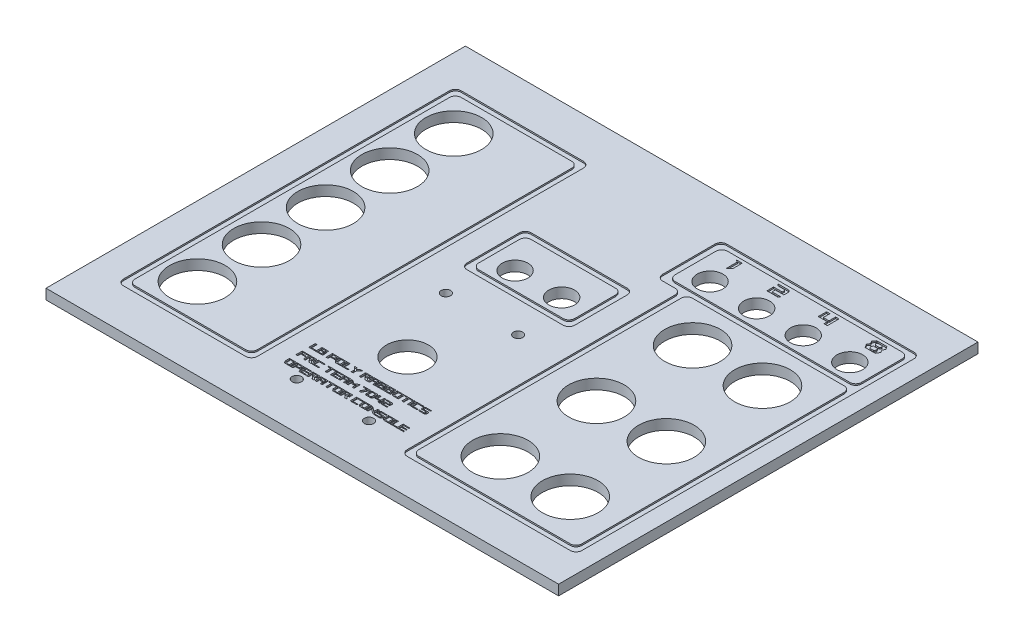
from build123d import *

# Parameters (mm, degrees)
SKETCH1_W           = 279.4
SKETCH1_H           = 228.6
BOSS_EXTRUDE1_DEPTH = 5.55625
SKETCH2_R           = 15.160625
CUT_EXTRUDE1_DEPTH  = 181.586411211
SKETCH3_R           = 7.0246875
SKETCH3_R_2         = 15.160625
CUT_EXTRUDE2_DEPTH  = 181.586411211
SKETCH4_W           = 73.025
SKETCH4_H           = 184.15
SKETCH4_W_2         = 66.675
SKETCH4_H_2         = 177.8
SKETCH4_W_3         = 88.9
SKETCH4_H_3         = 149.225
SKETCH4_W_4         = 101.6
SKETCH4_H_4         = 28.575
CUT_EXTRUDE3_DEPTH  = 0.79375
FILLET1_R           = 3.175
SKETCH5_W           = 1.743010591
SKETCH5_H           = 0.819065149
SKETCH5_H_2         = 1.141619432
SKETCH5_W_2         = 1.782964988
SKETCH5_H_3         = 1.234104295
SKETCH5_W_3         = 1.807936488
SKETCH5_H_4         = 0.965318114
SKETCH5_W_4         = 1.743010592
SKETCH5_W_5         = 1.049133865
SKETCH5_H_5         = 3.5
SKETCH5_W_6         = 1.807936487
SKETCH5_W_7         = 1.782964989
CUT_EXTRUDE4_DEPTH  = 0.79375
CUT_EXTRUDE5_DEPTH  = 0.79375
CUT_EXTRUDE6_DEPTH  = 0.79375
SKETCH8_R           = 7.0246875
CUT_EXTRUDE7_DEPTH  = 181.586411211
SKETCH9_R           = 11.43
SKETCH9_R_2         = 2.54
CUT_EXTRUDE8_DEPTH  = 181.586411211


with BuildPart() as part:
    # Sketch1 → Boss-Extrude1 (new body)
    with BuildSketch(Plane(origin=(0, 0, 0), x_dir=(1, 0, 0), z_dir=(0, 1, 0))):
        Rectangle(SKETCH1_W, SKETCH1_H)
    extrude(amount=BOSS_EXTRUDE1_DEPTH)

    # Sketch2 → Cut-Extrude1 (cut, through all)
    with BuildSketch(Plane(origin=(0, 5.55625, 0), x_dir=(1, 0, 0), z_dir=(0, 1, 0))):
        with Locations((-101.6, 69.85)):
            Circle(SKETCH2_R)
        with Locations((-101.6, 34.925)):
            Circle(SKETCH2_R)
        with Locations((-101.6, 0)):
            Circle(SKETCH2_R)
        with Locations((-101.6, -34.925)):
            Circle(SKETCH2_R)
        with Locations((-101.6, -69.85)):
            Circle(SKETCH2_R)
    extrude(amount=-CUT_EXTRUDE1_DEPTH, mode=Mode.SUBTRACT)

    # Sketch3 → Cut-Extrude2 (cut, through all)
    with BuildSketch(Plane(origin=(0, 5.55625, 0), x_dir=(1, 0, 0), z_dir=(0, 1, 0))):
        with Locations((38.1, 69.85)):
            Circle(SKETCH3_R)
        with Locations((63.5, 69.85)):
            Circle(SKETCH3_R)
        with Locations((88.9, 69.85)):
            Circle(SKETCH3_R)
        with Locations((114.3, 69.85)):
            Circle(SKETCH3_R)
        with Locations((63.5, 34.925)):
            Circle(SKETCH3_R_2)
        with Locations((101.6, 34.925)):
            Circle(SKETCH3_R_2)
        with Locations((101.6, -17.4625)):
            Circle(SKETCH3_R_2)
        with Locations((63.5, -17.4625)):
            Circle(SKETCH3_R_2)
        with Locations((101.6, -69.85)):
            Circle(SKETCH3_R_2)
        with Locations((63.5, -69.85)):
            Circle(SKETCH3_R_2)
    extrude(amount=-CUT_EXTRUDE2_DEPTH, mode=Mode.SUBTRACT)

    # Sketch4 → Cut-Extrude3 (cut)
    # profile 1 of 2: a face of its own
    with BuildSketch(Plane(origin=(0, 5.55625, 0), x_dir=(1, 0, 0), z_dir=(0, 1, 0))):
        with Locations((-86.439375, 0)):
            Rectangle(SKETCH4_W, SKETCH4_H)
        with Locations((-86.439375, 0)):
            Rectangle(SKETCH4_W_2, SKETCH4_H_2, mode=Mode.SUBTRACT)
    # profile 2 of 2: a face of its own
    with BuildSketch(Plane(origin=(0, 5.55625, 0), x_dir=(1, 0, 0), z_dir=(0, 1, 0))):
        Polygon((130.175, 60.325), (130.175, -95.25), (34.925, -95.25), (34.925, 57.15), (21.779463134, 57.15), (21.779463134, 92.075), (130.175, 92.075), align=None)
        with Locations((82.55, -17.4625)):
            Rectangle(SKETCH4_W_3, SKETCH4_H_3, mode=Mode.SUBTRACT)
        with Locations((76.2, 74.6125)):
            Rectangle(SKETCH4_W_4, SKETCH4_H_4, mode=Mode.SUBTRACT)
    extrude(amount=-CUT_EXTRUDE3_DEPTH, mode=Mode.SUBTRACT)

    # Fillet1
    fillet1_edges = [part.edges().sort_by_distance(p)[0] for p in [
        (130.175, 5.159375, 95.25),
        (127, 5.159375, 92.075),
        (34.925, 5.159375, 95.25),
        (38.1, 5.159375, 92.075),
        (-119.776875, 5.159375, 88.9),
        (-122.951875, 5.159375, 92.075),
        (-49.926875, 5.159375, 92.075),
        (-53.101875, 5.159375, 88.9),
        (38.1, 5.159375, -57.15),
        (127, 5.159375, -57.15),
        (34.925, 5.159375, -57.15),
        (127, 5.159375, -60.325),
        (130.175, 5.159375, -92.075),
        (127, 5.159375, -88.9),
        (21.779463134, 5.159375, -57.15),
        (25.4, 5.159375, -60.325),
        (21.779463134, 5.159375, -92.075),
        (25.4, 5.159375, -88.9),
        (-49.926875, 5.159375, -92.075),
        (-53.101875, 5.159375, -88.9),
        (-122.951875, 5.159375, -92.075),
        (-119.776875, 5.159375, -88.9),
    ]]
    fillet(fillet1_edges, radius=FILLET1_R)

    # Sketch5 → Cut-Extrude4 (cut)
    # profile 1 of 41: a face of its own
    with BuildSketch(Plane(origin=(0, 5.55625, 0), x_dir=(1, 0, 0), z_dir=(0, 1, 0))):
        Polygon((-36.802163997, -70.03379494), (-37.252626826, -70.54878923), (-40.209679135, -70.54878923), (-40.209679135, -67.04878923), (-39.163953361, -67.04878923), (-39.163953361, -70.03379494), align=None)
    # profile 2 of 41: a face of its own
    with BuildSketch(Plane(origin=(0, 5.55625, 0), x_dir=(1, 0, 0), z_dir=(0, 1, 0))):
        Polygon((-32.683092397, -70.55453218), (-36.513720258, -70.55453218), (-36.513720258, -67.04247403), (-32.987744678, -67.04247403), (-32.987744678, -68.375952047), (-32.683092397, -68.375952047), align=None)
        with Locations((-34.598406328, -67.966419473)):
            Rectangle(SKETCH5_W, SKETCH5_H, mode=Mode.SUBTRACT)
        with Locations((-34.598406328, -69.469309596)):
            Rectangle(SKETCH5_W, SKETCH5_H_2, mode=Mode.SUBTRACT)
    # profile 3 of 41: a face of its own
    with BuildSketch(Plane(origin=(0, 5.55625, 0), x_dir=(1, 0, 0), z_dir=(0, 1, 0))):
        Polygon((-29.773910712, -69.305977015), (-29.773910712, -70.544563338), (-30.822713646, -70.544563338), (-30.822713646, -67.043046984), (-26.952131388, -67.043046984), (-26.952131388, -69.305977015), align=None)
        with Locations((-28.892416817, -68.174511999)):
            Rectangle(SKETCH5_W_2, SKETCH5_H_3, mode=Mode.SUBTRACT)
    # profile 4 of 41: a face of its own
    with BuildSketch(Plane(origin=(0, 5.55625, 0), x_dir=(1, 0, 0), z_dir=(0, 1, 0))):
        Polygon((-22.605629343, -70.553124491), (-22.605629343, -67.044453969), (-26.568057888, -67.044453969), (-26.568057888, -69.594269754), (-25.714708614, -70.553124491), align=None)
        Polygon((-23.654763208, -67.547344949), (-23.654763208, -70.050234216), (-24.928968668, -70.050234216), (-25.518924023, -69.366287524), (-25.518924023, -67.547344949), align=None, mode=Mode.SUBTRACT)
    # profile 5 of 41: a face of its own
    with BuildSketch(Plane(origin=(0, 5.55625, 0), x_dir=(1, 0, 0), z_dir=(0, 1, 0))):
        Polygon((-18.813721064, -70.03379494), (-19.264183893, -70.54878923), (-22.221236202, -70.54878923), (-22.221236202, -67.04878923), (-21.175510428, -67.04878923), (-21.175510428, -70.03379494), align=None)
    # profile 6 of 41: a face of its own
    with BuildSketch(Plane(origin=(0, 5.55625, 0), x_dir=(1, 0, 0), z_dir=(0, 1, 0))):
        Polygon((-17.088287191, -70.553125196), (-16.039154031, -70.553125196), (-16.039154031, -68.905006299), (-14.401023733, -67.057115414), (-15.609644258, -67.057115414), (-16.563737545, -68.135884147), (-17.517796964, -67.057115414), (-18.726417488, -67.057115414), (-17.088287191, -68.905006299), align=None)
    # profile 7 of 41: a face of its own
    with BuildSketch(Plane(origin=(0, 5.55625, 0), x_dir=(1, 0, 0), z_dir=(0, 1, 0))):
        Polygon((-8.386582238, -70.573506709), (-9.620174261, -70.573506709), (-11.503025243, -68.425957843), (-9.735043154, -68.425957843), (-9.735043154, -67.599367375), (-11.635973953, -67.599367375), (-11.635973953, -70.573506709), (-12.694765486, -70.573506709), (-12.694765486, -67.084954507), (-8.706217418, -67.084954507), (-8.706217418, -68.940370711), (-9.814951949, -68.940370711), align=None)
    # profile 8 of 41: a face of its own
    with BuildSketch(Plane(origin=(0, 5.55625, 0), x_dir=(1, 0, 0), z_dir=(0, 1, 0))):
        Polygon((-4.199478651, -67.084954507), (-4.199478651, -70.572393964), (-5.248281586, -70.572393964), (-5.248281586, -69.084092657), (-7.096172471, -69.084092657), (-7.096172471, -70.572393964), (-8.164952604, -70.572393964), (-8.164952604, -67.084954507), align=None)
        with Locations((-6.177221328, -68.082026432)):
            Rectangle(SKETCH5_W_3, SKETCH5_H_4, mode=Mode.SUBTRACT)
    # profile 9 of 41: a face of its own
    with BuildSketch(Plane(origin=(0, 5.55625, 0), x_dir=(1, 0, 0), z_dir=(0, 1, 0))):
        Polygon((0.010555813, -70.55453218), (-3.820072048, -70.55453218), (-3.820072048, -67.04247403), (-0.294096468, -67.04247403), (-0.294096468, -68.375952047), (0.010555813, -68.375952047), align=None)
        with Locations((-1.904758118, -67.966419473)):
            Rectangle(SKETCH5_W, SKETCH5_H, mode=Mode.SUBTRACT)
        with Locations((-1.904758118, -69.469309596)):
            Rectangle(SKETCH5_W, SKETCH5_H_2, mode=Mode.SUBTRACT)
    # profile 10 of 41: a face of its own
    with BuildSketch(Plane(origin=(0, 5.55625, 0), x_dir=(1, 0, 0), z_dir=(0, 1, 0))):
        Polygon((4.218649146, -70.55453218), (0.388021286, -70.55453218), (0.388021286, -67.04247403), (3.913996865, -67.04247403), (3.913996865, -68.375952047), (4.218649146, -68.375952047), align=None)
        with Locations((2.303335216, -67.966419473)):
            Rectangle(SKETCH5_W_4, SKETCH5_H, mode=Mode.SUBTRACT)
        with Locations((2.303335216, -69.469309596)):
            Rectangle(SKETCH5_W_4, SKETCH5_H_2, mode=Mode.SUBTRACT)
    # profile 11 of 41: a face of its own
    with BuildSketch(Plane(origin=(0, 5.55625, 0), x_dir=(1, 0, 0), z_dir=(0, 1, 0))):
        Polygon((8.562006998, -70.553124491), (8.562006998, -67.044453969), (4.599578454, -67.044453969), (4.599578454, -69.594269754), (5.452927727, -70.553124491), align=None)
        Polygon((7.512873133, -67.547344949), (7.512873133, -70.050234216), (6.238667674, -70.050234216), (5.648712319, -69.366287524), (5.648712319, -67.547344949), align=None, mode=Mode.SUBTRACT)
    # profile 12 of 41: a face of its own
    with BuildSketch(Plane(origin=(0, 5.55625, 0), x_dir=(1, 0, 0), z_dir=(0, 1, 0))):
        Polygon((12.839335381, -67.563822328), (11.5483703, -67.563822328), (11.5483703, -70.54878923), (10.506626277, -70.54878923), (10.506626277, -67.563822328), (9.200707932, -67.563822328), (8.757094448, -67.04878923), (13.28310551, -67.04878923), align=None)
    # profile 13 of 41: a face of its own
    with BuildSketch(Plane(origin=(0, 5.55625, 0), x_dir=(1, 0, 0), z_dir=(0, 1, 0))):
        with Locations((14.09524546, -68.79878923)):
            Rectangle(SKETCH5_W_5, SKETCH5_H_5)
    # profile 14 of 41: a face of its own
    with BuildSketch(Plane(origin=(0, 5.55625, 0), x_dir=(1, 0, 0), z_dir=(0, 1, 0))):
        Polygon((19.063454202, -70.03379494), (18.615261317, -70.54878923), (15.138597919, -70.54878923), (15.138597919, -67.04878923), (19.058560804, -67.04878923), (18.615261317, -67.563822328), (16.204509047, -67.563822328), (16.204509047, -70.03379494), align=None)
    # profile 15 of 41: a face of its own
    with BuildSketch(Plane(origin=(0, 5.55625, 0), x_dir=(1, 0, 0), z_dir=(0, 1, 0))):
        Polygon((23.383155104, -70.029679123), (22.930792776, -70.558867441), (19.794082567, -70.558867441), (19.346691253, -70.044454573), (22.14537247, -70.044454573), (22.32930001, -69.832673123), (22.32930001, -69.079135754), (19.480908647, -69.079135754), (19.480908647, -67.638932277), (19.953155034, -67.084954507), (23.50276075, -67.084954507), (23.06501017, -67.599367375), (20.743546354, -67.599367375), (20.519850698, -67.85180601), (20.519850698, -68.564685489), (23.383155104, -68.564685489), align=None)
    # profile 16 of 41: a face of its own
    with BuildSketch(Plane(origin=(0, 5.55625, 0), x_dir=(1, 0, 0), z_dir=(0, 1, 0))):
        Polygon((-39.190410166, -75.905689832), (-39.190410166, -77.568791629), (-40.209679135, -77.568791629), (-40.209679135, -74.096516413), (-36.432222432, -74.096516413), (-36.872072903, -74.610929281), (-39.190410166, -74.610929281), (-39.190410166, -75.391276965), (-36.577284329, -75.391276965), (-37.026961815, -75.905689832), align=None)
    # profile 17 of 41: a face of its own
    with BuildSketch(Plane(origin=(0, 5.55625, 0), x_dir=(1, 0, 0), z_dir=(0, 1, 0))):
        Polygon((-31.83167367, -77.585068614), (-33.065265693, -77.585068614), (-34.948116675, -75.437519748), (-33.180134585, -75.437519748), (-33.180134585, -74.610929281), (-35.081065384, -74.610929281), (-35.081065384, -77.585068614), (-36.139856918, -77.585068614), (-36.139856918, -74.096516413), (-32.15130885, -74.096516413), (-32.15130885, -75.951932616), (-33.26004338, -75.951932616), align=None)
    # profile 18 of 41: a face of its own
    with BuildSketch(Plane(origin=(0, 5.55625, 0), x_dir=(1, 0, 0), z_dir=(0, 1, 0))):
        Polygon((-27.68800031, -77.045356846), (-28.136193195, -77.560351135), (-31.612856593, -77.560351135), (-31.612856593, -74.060351135), (-27.692893708, -74.060351135), (-28.136193195, -74.575384233), (-30.546945465, -74.575384233), (-30.546945465, -77.045356846), align=None)
    # profile 19 of 41: a face of its own
    with BuildSketch(Plane(origin=(0, 5.55625, 0), x_dir=(1, 0, 0), z_dir=(0, 1, 0))):
        Polygon((-21.981480887, -74.575384233), (-23.272445969, -74.575384233), (-23.272445969, -77.560351135), (-24.314189992, -77.560351135), (-24.314189992, -74.575384233), (-25.620108337, -74.575384233), (-26.06372182, -74.060351135), (-21.537710758, -74.060351135), align=None)
    # profile 20 of 41: a face of its own
    with BuildSketch(Plane(origin=(0, 5.55625, 0), x_dir=(1, 0, 0), z_dir=(0, 1, 0))):
        Polygon((-17.881404278, -77.056016479), (-17.431980811, -77.570429347), (-21.346958569, -77.570429347), (-21.346958569, -74.096516413), (-17.422102287, -74.096516413), (-17.866423496, -74.610929281), (-20.298303813, -74.610929281), (-20.298303813, -75.576247395), (-17.656692545, -75.576247395), (-17.656692545, -76.09069766), (-20.298303813, -76.09069766), (-20.298303813, -77.056016479), align=None)
    # profile 21 of 41: a face of its own
    with BuildSketch(Plane(origin=(0, 5.55625, 0), x_dir=(1, 0, 0), z_dir=(0, 1, 0))):
        Polygon((-13.170578726, -74.096516413), (-13.170578726, -77.583955869), (-14.21938166, -77.583955869), (-14.21938166, -76.095654562), (-16.067272545, -76.095654562), (-16.067272545, -77.583955869), (-17.136052678, -77.583955869), (-17.136052678, -74.096516413), align=None)
        with Locations((-15.148321403, -75.093588338)):
            Rectangle(SKETCH5_W_6, SKETCH5_H_4, mode=Mode.SUBTRACT)
    # profile 22 of 41: a face of its own
    with BuildSketch(Plane(origin=(0, 5.55625, 0), x_dir=(1, 0, 0), z_dir=(0, 1, 0))):
        Polygon((-12.79204355, -77.560351135), (-12.79204355, -74.060351135), (-10.64467038, -75.46037442), (-8.497245702, -74.060351135), (-8.497245702, -77.560351135), (-9.528634209, -77.560351135), (-9.528634209, -75.555373367), (-10.64467038, -76.265365494), (-11.750741943, -75.555373367), (-11.750741943, -77.560351135), align=None)
    # profile 23 of 41: a face of its own
    with BuildSketch(Plane(origin=(0, 5.55625, 0), x_dir=(1, 0, 0), z_dir=(0, 1, 0))):
        Polygon((-5.907196803, -77.564687102), (-4.701469275, -77.564687102), (-2.855625362, -74.056015874), (-6.780480939, -74.056015874), (-6.338877029, -74.558906855), (-4.438491666, -74.558906855), align=None)
    # profile 24 of 41: a face of its own
    with BuildSketch(Plane(origin=(0, 5.55625, 0), x_dir=(1, 0, 0), z_dir=(0, 1, 0))):
        Polygon((1.259981699, -74.609532881), (0.796130647, -74.056015874), (-2.196113199, -74.056015874), (-2.664873878, -74.609532881), (-2.664873878, -77.01133803), (-2.196113199, -77.564686396), (0.796130647, -77.564686396), (1.259981699, -77.01133803), align=None)
        Polygon((0.248420801, -74.851731719), (0.248420801, -76.759047573), (-0.004468012, -77.061796121), (-1.395364246, -77.061796121), (-1.653312275, -76.759047573), (-1.653312275, -74.851731719), (-1.395364246, -74.558906855), (-0.004468012, -74.558906855), align=None, mode=Mode.SUBTRACT)
    # profile 25 of 41: a face of its own
    with BuildSketch(Plane(origin=(0, 5.55625, 0), x_dir=(1, 0, 0), z_dir=(0, 1, 0))):
        Polygon((4.410271351, -77.564687102), (5.421832955, -77.564687102), (5.421832955, -74.066712199), (4.410271351, -74.066712199), (4.410271351, -76.044454876), (2.693509411, -76.044454876), (2.693509411, -74.066712199), (1.681947807, -74.066712199), (1.681947807, -76.547345856), (4.410271351, -76.547345856), align=None)
    # profile 26 of 41: a face of its own
    with BuildSketch(Plane(origin=(0, 5.55625, 0), x_dir=(1, 0, 0), z_dir=(0, 1, 0))):
        Polygon((9.180457662, -77.570429347), (5.871108244, -77.570429347), (5.871108244, -75.576247395), (8.451701983, -75.576247395), (8.451701983, -74.863367916), (8.227085507, -74.610929281), (6.190562788, -74.610929281), (5.75131279, -74.096516413), (9.02073039, -74.096516413), (9.494920729, -74.650494182), (9.494920729, -76.09069766), (6.929301421, -76.09069766), (6.929301421, -77.056016479), (9.629925583, -77.056016479), align=None)
    # profile 27 of 41: a face of its own
    with BuildSketch(Plane(origin=(0, 5.55625, 0), x_dir=(1, 0, 0), z_dir=(0, 1, 0))):
        Polygon((-36.247250591, -84.576248302), (-36.247250591, -81.06757778), (-40.209679135, -81.06757778), (-40.209679135, -83.617393565), (-39.356329862, -84.576248302), align=None)
        Polygon((-37.296384456, -81.57046876), (-37.296384456, -84.073358027), (-38.570589915, -84.073358027), (-39.16054527, -83.389411335), (-39.16054527, -81.57046876), align=None, mode=Mode.SUBTRACT)
    # profile 28 of 41: a face of its own
    with BuildSketch(Plane(origin=(0, 5.55625, 0), x_dir=(1, 0, 0), z_dir=(0, 1, 0))):
        Polygon((-34.814374156, -83.329100826), (-34.814374156, -84.567687149), (-35.86317709, -84.567687149), (-35.86317709, -81.066170796), (-31.992594832, -81.066170796), (-31.992594832, -83.329100826), align=None)
        with Locations((-33.93288026, -82.197635812)):
            Rectangle(SKETCH5_W_7, SKETCH5_H_3, mode=Mode.SUBTRACT)
    # profile 29 of 41: a face of its own
    with BuildSketch(Plane(origin=(0, 5.55625, 0), x_dir=(1, 0, 0), z_dir=(0, 1, 0))):
        Polygon((-28.147302302, -84.067578385), (-27.697878834, -84.581991252), (-31.612856593, -84.581991252), (-31.612856593, -81.108078319), (-27.68800031, -81.108078319), (-28.132321519, -81.622491186), (-30.564201836, -81.622491186), (-30.564201836, -82.5878093), (-27.922590568, -82.5878093), (-27.922590568, -83.102259565), (-30.564201836, -83.102259565), (-30.564201836, -84.067578385), align=None)
    # profile 30 of 41: a face of its own
    with BuildSketch(Plane(origin=(0, 5.55625, 0), x_dir=(1, 0, 0), z_dir=(0, 1, 0))):
        Polygon((-23.091787515, -84.59663052), (-24.325379538, -84.59663052), (-26.20823052, -82.449081654), (-24.44024843, -82.449081654), (-24.44024843, -81.622491186), (-26.341179229, -81.622491186), (-26.341179229, -84.59663052), (-27.399970763, -84.59663052), (-27.399970763, -81.108078319), (-23.411422695, -81.108078319), (-23.411422695, -82.963494522), (-24.520157225, -82.963494522), align=None)
    # profile 31 of 41: a face of its own
    with BuildSketch(Plane(origin=(0, 5.55625, 0), x_dir=(1, 0, 0), z_dir=(0, 1, 0))):
        Polygon((-18.904683928, -81.108078319), (-18.904683928, -84.595517775), (-19.953486863, -84.595517775), (-19.953486863, -83.107216468), (-21.801377747, -83.107216468), (-21.801377747, -84.595517775), (-22.870157881, -84.595517775), (-22.870157881, -81.108078319), align=None)
        with Locations((-20.882426605, -82.105150243)):
            Rectangle(SKETCH5_W_6, SKETCH5_H_4, mode=Mode.SUBTRACT)
    # profile 32 of 41: a face of its own
    with BuildSketch(Plane(origin=(0, 5.55625, 0), x_dir=(1, 0, 0), z_dir=(0, 1, 0))):
        Polygon((-14.628878249, -81.586946139), (-15.91984333, -81.586946139), (-15.91984333, -84.571913041), (-16.961587353, -84.571913041), (-16.961587353, -81.586946139), (-18.267505698, -81.586946139), (-18.711119182, -81.071913041), (-14.18510812, -81.071913041), align=None)
    # profile 33 of 41: a face of its own
    with BuildSketch(Plane(origin=(0, 5.55625, 0), x_dir=(1, 0, 0), z_dir=(0, 1, 0))):
        Polygon((-10.027592125, -84.576248302), (-10.027592125, -81.06757778), (-13.99002067, -81.06757778), (-13.99002067, -83.617393565), (-13.136671397, -84.576248302), align=None)
        Polygon((-11.076725991, -81.57046876), (-11.076725991, -84.073358027), (-12.35093145, -84.073358027), (-12.940886805, -83.389411335), (-12.940886805, -81.57046876), align=None, mode=Mode.SUBTRACT)
    # profile 34 of 41: a face of its own
    with BuildSketch(Plane(origin=(0, 5.55625, 0), x_dir=(1, 0, 0), z_dir=(0, 1, 0))):
        Polygon((-5.334558501, -84.59663052), (-6.568150524, -84.59663052), (-8.451001507, -82.449081654), (-6.683019417, -82.449081654), (-6.683019417, -81.622491186), (-8.583950216, -81.622491186), (-8.583950216, -84.59663052), (-9.64274175, -84.59663052), (-9.64274175, -81.108078319), (-5.654193681, -81.108078319), (-5.654193681, -82.963494522), (-6.762928212, -82.963494522), align=None)
    # profile 35 of 41: a face of its own
    with BuildSketch(Plane(origin=(0, 5.55625, 0), x_dir=(1, 0, 0), z_dir=(0, 1, 0))):
        Polygon((0.288883943, -84.056918751), (-0.159308942, -84.571913041), (-3.63597234, -84.571913041), (-3.63597234, -81.071913041), (0.283990545, -81.071913041), (-0.159308942, -81.586946139), (-2.570061212, -81.586946139), (-2.570061212, -84.056918751), align=None)
    # profile 36 of 41: a face of its own
    with BuildSketch(Plane(origin=(0, 5.55625, 0), x_dir=(1, 0, 0), z_dir=(0, 1, 0))):
        Polygon((4.585127584, -84.576248302), (4.585127584, -81.06757778), (0.622699039, -81.06757778), (0.622699039, -83.617393565), (1.476048312, -84.576248302), align=None)
        Polygon((3.535993718, -81.57046876), (3.535993718, -84.073358027), (2.261788259, -84.073358027), (1.671832904, -83.389411335), (1.671832904, -81.57046876), align=None, mode=Mode.SUBTRACT)
    # profile 37 of 41: a face of its own
    with BuildSketch(Plane(origin=(0, 5.55625, 0), x_dir=(1, 0, 0), z_dir=(0, 1, 0))):
        Polygon((8.890041041, -84.571913041), (6.048010742, -82.666934164), (6.048010742, -84.571913041), (5.011428248, -84.571913041), (5.011428248, -81.071913041), (7.868229763, -82.961930893), (7.868229763, -81.071913041), (8.890041041, -81.071913041), align=None)
    # profile 38 of 41: a face of its own
    with BuildSketch(Plane(origin=(0, 5.55625, 0), x_dir=(1, 0, 0), z_dir=(0, 1, 0))):
        Polygon((13.255985433, -84.052802935), (12.803623104, -84.581991252), (9.666912895, -84.581991252), (9.219521581, -84.067578385), (12.018202798, -84.067578385), (12.202130338, -83.855796934), (12.202130338, -83.102259565), (9.353738975, -83.102259565), (9.353738975, -81.662056088), (9.825985362, -81.108078319), (13.375591078, -81.108078319), (12.937840498, -81.622491186), (10.616376683, -81.622491186), (10.392681026, -81.874929821), (10.392681026, -82.5878093), (13.255985433, -82.5878093), align=None)
    # profile 39 of 41: a face of its own
    with BuildSketch(Plane(origin=(0, 5.55625, 0), x_dir=(1, 0, 0), z_dir=(0, 1, 0))):
        Polygon((17.671835424, -84.576248302), (17.671835424, -81.06757778), (13.70940688, -81.06757778), (13.70940688, -83.617393565), (14.562756153, -84.576248302), align=None)
        Polygon((16.622701559, -81.57046876), (16.622701559, -84.073358027), (15.3484961, -84.073358027), (14.758540745, -83.389411335), (14.758540745, -81.57046876), align=None, mode=Mode.SUBTRACT)
    # profile 40 of 41: a face of its own
    with BuildSketch(Plane(origin=(0, 5.55625, 0), x_dir=(1, 0, 0), z_dir=(0, 1, 0))):
        Polygon((21.463743703, -84.056918751), (21.013280874, -84.571913041), (18.056228565, -84.571913041), (18.056228565, -81.071913041), (19.101954339, -81.071913041), (19.101954339, -84.056918751), align=None)
    # profile 41 of 41: a face of its own
    with BuildSketch(Plane(origin=(0, 5.55625, 0), x_dir=(1, 0, 0), z_dir=(0, 1, 0))):
        Polygon((25.216870306, -84.067578385), (25.666293774, -84.581991252), (21.751316015, -84.581991252), (21.751316015, -81.108078319), (25.676172298, -81.108078319), (25.231851089, -81.622491186), (22.799970772, -81.622491186), (22.799970772, -82.5878093), (25.44158204, -82.5878093), (25.44158204, -83.102259565), (22.799970772, -83.102259565), (22.799970772, -84.067578385), align=None)
    extrude(amount=-CUT_EXTRUDE4_DEPTH, mode=Mode.SUBTRACT)

    # Sketch6 → Cut-Extrude5 (cut)
    # profile 1 of 4: a face of its own
    with BuildSketch(Plane(origin=(0, 5.55625, 0), x_dir=(1, 0, 0), z_dir=(0, 1, 0))):
        Polygon((36.349512189, 86.430530343), (34.879649813, 87.249576783), (38.225068778, 87.249576783), (38.225068778, 82.021334949), (36.349512189, 80.212665002), align=None)
    # profile 2 of 4: a face of its own
    with BuildSketch(Plane(origin=(0, 5.55625, 0), x_dir=(1, 0, 0), z_dir=(0, 1, 0))):
        Polygon((64.005149228, 80.957324248), (58.001043854, 80.957324248), (58.001043854, 84.575340076), (62.682978211, 84.575340076), (62.682978211, 85.86870713), (62.275459746, 86.326702939), (58.58062567, 86.326702939), (57.783700673, 87.259994857), (63.71535832, 87.259994857), (64.575675078, 86.254920904), (64.575675078, 83.641980309), (59.920908619, 83.641980309), (59.920908619, 81.890616165), (64.820612455, 81.890616165), align=None)
    # profile 3 of 4: a face of its own
    with BuildSketch(Plane(origin=(0, 5.55625, 0), x_dir=(1, 0, 0), z_dir=(0, 1, 0))):
        Polygon((89.077512473, 80.967742321), (90.912774239, 80.967742321), (90.912774239, 87.314068216), (89.077512473, 87.314068216), (89.077512473, 83.725877931), (85.96281581, 83.725877931), (85.96281581, 87.314068216), (84.127554044, 87.314068216), (84.127554044, 82.81349001), (89.077512473, 82.81349001), align=None)
    # profile 4 of 4: a face of its own
    with BuildSketch(Plane(origin=(0, 5.55625, 0), x_dir=(1, 0, 0), z_dir=(0, 1, 0))):
        Polygon((118.179500174, 82.933671664), (117.229695264, 84.39132372), (118.179500174, 85.609481708), (116.994606282, 87.333474406), (111.488098965, 87.333474406), (110.30361217, 85.609481708), (111.253009983, 84.39132372), (110.30361217, 82.933671664), (111.488098965, 80.967743601), (116.994606282, 80.967743601), align=None)
        Polygon((112.564083154, 85.609481708), (113.187973145, 86.421086484), (115.294732102, 86.421086484), (115.918622094, 85.609481708), (115.294732102, 84.81654702), (113.187973145, 84.81654702), align=None, mode=Mode.SUBTRACT)
        Polygon((115.918622094, 82.933671664), (115.285690218, 81.880130243), (113.197015029, 81.880130243), (112.564083154, 82.952154846), (113.169889377, 83.904159098), (115.31281587, 83.904159098), align=None, mode=Mode.SUBTRACT)
    extrude(amount=-CUT_EXTRUDE5_DEPTH, mode=Mode.SUBTRACT)

    # Sketch7 → Cut-Extrude6 (cut)
    with BuildSketch(Plane(origin=(0, 5.55625, 0), x_dir=(1, 0, 0), z_dir=(0, 1, 0))):
        with BuildLine():
            Line((-33.6946875, 44.0928125), (18.6928125, 44.0928125))
            ThreePointArc((18.6928125, 44.0928125), (20.93787653, 43.16287653), (21.8678125, 40.9178125))
            Line((21.8678125, 40.9178125), (21.8678125, 12.3428125))
            ThreePointArc((21.8678125, 12.3428125), (20.93787653, 10.09774847), (18.6928125, 9.1678125))
            Line((18.6928125, 9.1678125), (-33.6946875, 9.1678125))
            ThreePointArc((-33.6946875, 9.1678125), (-35.93975153, 10.09774847), (-36.8696875, 12.3428125))
            Line((-36.8696875, 12.3428125), (-36.8696875, 40.9178125))
            ThreePointArc((-36.8696875, 40.9178125), (-35.93975153, 43.16287653), (-33.6946875, 44.0928125))
        make_face()
        with BuildLine():
            Line((-30.5196875, 40.9178125), (15.5178125, 40.9178125))
            ThreePointArc((15.5178125, 40.9178125), (17.76287653, 39.98787653), (18.6928125, 37.7428125))
            Line((18.6928125, 37.7428125), (18.6928125, 15.5178125))
            ThreePointArc((18.6928125, 15.5178125), (17.76287653, 13.27274847), (15.5178125, 12.3428125))
            Line((15.5178125, 12.3428125), (-30.5196875, 12.3428125))
            ThreePointArc((-30.5196875, 12.3428125), (-32.76475153, 13.27274847), (-33.6946875, 15.5178125))
            Line((-33.6946875, 15.5178125), (-33.6946875, 37.7428125))
            ThreePointArc((-33.6946875, 37.7428125), (-32.76475153, 39.98787653), (-30.5196875, 40.9178125))
        make_face(mode=Mode.SUBTRACT)
    extrude(amount=-CUT_EXTRUDE6_DEPTH, mode=Mode.SUBTRACT)

    # Sketch8 → Cut-Extrude7 (cut, through all)
    with BuildSketch(Plane(origin=(0, 5.55625, 0), x_dir=(1, 0, 0), z_dir=(0, 1, 0))):
        with Locations((-20.2009375, 21.8678125)):
            Circle(SKETCH8_R)
        with Locations((5.1990625, 21.8678125)):
            Circle(SKETCH8_R)
    extrude(amount=-CUT_EXTRUDE7_DEPTH, mode=Mode.SUBTRACT)

    # Sketch9 → Cut-Extrude8 (cut, through all)
    with BuildSketch(Plane(origin=(0, 5.55625, 0), x_dir=(1, 0, 0), z_dir=(0, 1, 0))):
        with Locations((-8.725427112, -48.26)):
            Circle(SKETCH9_R)
        with Locations((10.959572888, -7.62)):
            Circle(SKETCH9_R_2)
        with Locations((10.959572888, -88.9)):
            Circle(SKETCH9_R_2)
        with Locations((-28.410427112, -7.62)):
            Circle(SKETCH9_R_2)
        with Locations((-28.410427112, -88.9)):
            Circle(SKETCH9_R_2)
    extrude(amount=-CUT_EXTRUDE8_DEPTH, mode=Mode.SUBTRACT)


solid = part.part
